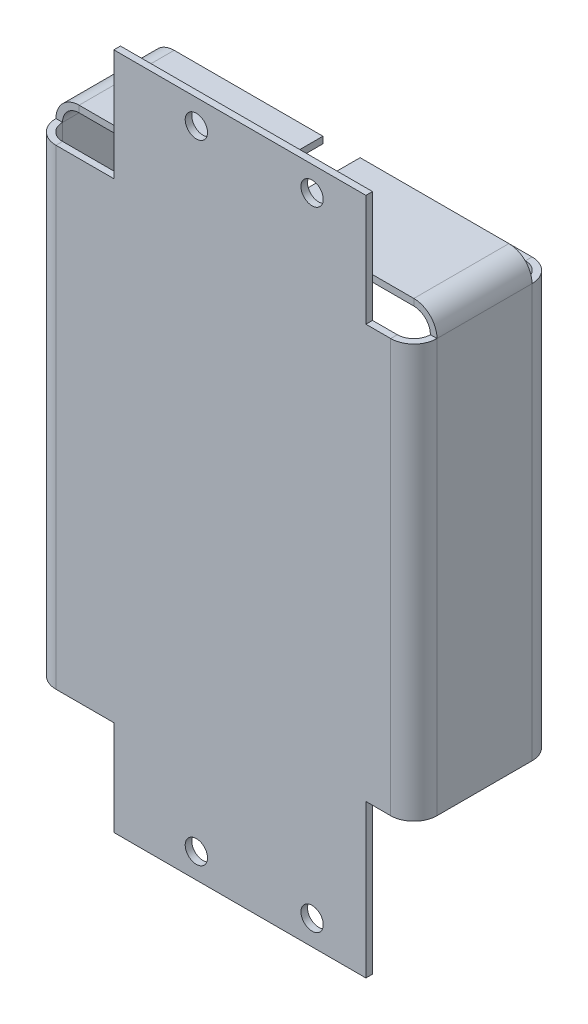
from build123d import *

# Parameters (mm, degrees)
SKETCH1_R                      = 1.35
BASE_FLANGE1_DEPTH             = 0.8
EDGE_FLANGE1_STRIP_W           = 7.2
EDGE_FLANGE1_STRIP_H           = 0.8
EDGE_FLANGE1_STRIP_CUT_DEPTH   = 50
EDGE_FLANGE1_STRIP_2_W         = 7.2
EDGE_FLANGE1_STRIP_2_H         = 0.8
EDGE_FLANGE1_STRIP_CUT_2_DEPTH = 57
EDGE_FLANGE1_DEPTH             = 50
EDGE_FLANGE1_BEND_DEPTH        = 57
EDGE_FLANGE4_DEPTH             = 11.5
EDGE_FLANGE4_BEND_DEPTH        = 11.5
EDGE_FLANGE5_DEPTH             = 50
EDGE_FLANGE5_BEND_DEPTH        = 57


# Sheet-metal steps are written as plain solids
with BuildPart() as part:
    # Sketch1 → Base-Flange1 (new body)
    with BuildSketch(Plane.XY):
        Polygon((16.75, 0), (16.75, -18.5), (-13.75, -18.5), (-13.75, -7), (-22.75, -7), (-22.75, 50), (-13.75, 50), (-13.75, 63.5), (16.75, 63.5), (16.75, 50), (21.75, 50), (21.75, 0), align=None)
        with Locations((10.237756115, -15.5)):
            Circle(SKETCH1_R, mode=Mode.SUBTRACT)
        with Locations((-3.762243885, -15.5)):
            Circle(SKETCH1_R, mode=Mode.SUBTRACT)
        with Locations((10.237756115, 60.5)):
            Circle(SKETCH1_R, mode=Mode.SUBTRACT)
        with Locations((-3.762243885, 60.5)):
            Circle(SKETCH1_R, mode=Mode.SUBTRACT)
    extrude(amount=BASE_FLANGE1_DEPTH)

    # Edge-Flange1 strip (across the edge) → Edge-Flange1 strip cut (cut)
    with BuildSketch(Plane(origin=(21.75, 50, 0), x_dir=(-1, 0, 0), z_dir=(0, -1, 0))):
        with Locations((-1.6, -0.4)):
            Rectangle(EDGE_FLANGE1_STRIP_W, EDGE_FLANGE1_STRIP_H)
    extrude(amount=EDGE_FLANGE1_STRIP_CUT_DEPTH, mode=Mode.SUBTRACT)

    # Edge-Flange1 strip 2 (across the edge) → Edge-Flange1 strip cut 2 (cut)
    with BuildSketch(Plane(origin=(-22.75, -7, 0), x_dir=(1, 0, 0), z_dir=(0, 1, 0))):
        with Locations((-1.6, -0.4)):
            Rectangle(EDGE_FLANGE1_STRIP_2_W, EDGE_FLANGE1_STRIP_2_H)
    extrude(amount=EDGE_FLANGE1_STRIP_CUT_2_DEPTH, mode=Mode.SUBTRACT)

    # Edge-Flange1 section (across the edge) → Edge-Flange1 (add)
    with BuildSketch(Plane(origin=(21.75, 50, 0), x_dir=(-1, 0, 0), z_dir=(0, -1, 0))):
        with BuildLine():
            Line((-0.8, 2), (-0.8, 13.5))
            Line((-0.8, 13.5), (0, 13.5))
            Line((0, 13.5), (0, 2))
            ThreePointArc((0, 2), (0.585786438, 0.585786438), (2, 0))
            Line((2, 0), (2, -0.8))
            ThreePointArc((2, -0.8), (0.020101013, 0.020101013), (-0.8, 2))
        make_face()
    extrude(amount=EDGE_FLANGE1_DEPTH)

    # Edge-Flange1 section 2 (across the edge) → Edge-Flange1 bend (add)
    with BuildSketch(Plane(origin=(-22.75, -7, 0), x_dir=(1, 0, 0), z_dir=(0, 1, 0))):
        with BuildLine():
            Line((-0.8, 2), (-0.8, 13.5))
            Line((-0.8, 13.5), (0, 13.5))
            Line((0, 13.5), (0, 2))
            ThreePointArc((0, 2), (0.585786438, 0.585786438), (2, 0))
            Line((2, 0), (2, -0.8))
            ThreePointArc((2, -0.8), (0.020101013, 0.020101013), (-0.8, 2))
        make_face()
    extrude(amount=EDGE_FLANGE1_BEND_DEPTH)

    # Edge-Flange4 section (across the edge) → Edge-Flange4 (add)
    with BuildSketch(Plane(origin=(21.75, 52, -2), x_dir=(0, -1, 0), z_dir=(0, 0, -1))):
        with BuildLine():
            Line((-0.8, 2), (-0.8, 20))
            Line((-0.8, 20), (0, 20))
            Line((0, 20), (0, 2))
            ThreePointArc((0, 2), (0.585786438, 0.585786438), (2, 0))
            Line((2, 0), (2, -0.8))
            ThreePointArc((2, -0.8), (0.020101013, 0.020101013), (-0.8, 2))
        make_face()
    extrude(amount=EDGE_FLANGE4_DEPTH)

    # Edge-Flange4 section 2 (across the edge) → Edge-Flange4 bend (add)
    with BuildSketch(Plane(origin=(-22.75, 52, -13.5), x_dir=(0, -1, 0), z_dir=(0, 0, 1))):
        with BuildLine():
            Line((-0.8, 2), (-0.8, 20))
            Line((-0.8, 20), (0, 20))
            Line((0, 20), (0, 2))
            ThreePointArc((0, 2), (0.585786438, 0.585786438), (2, 0))
            Line((2, 0), (2, -0.8))
            ThreePointArc((2, -0.8), (0.020101013, 0.020101013), (-0.8, 2))
        make_face()
    extrude(amount=EDGE_FLANGE4_BEND_DEPTH)

    # Edge-Flange5 section (across the edge) → Edge-Flange5 (add)
    with BuildSketch(Plane(origin=(21.75, 50, -15.5), x_dir=(0, 0, 1), z_dir=(0, -1, 0))):
        with BuildLine():
            Line((-0.8, 2), (-0.8, 10))
            Line((-0.8, 10), (0, 10))
            Line((0, 10), (0, 2))
            ThreePointArc((0, 2), (0.585786438, 0.585786438), (2, 0))
            Line((2, 0), (2, -0.8))
            ThreePointArc((2, -0.8), (0.020101013, 0.020101013), (-0.8, 2))
        make_face()
    extrude(amount=EDGE_FLANGE5_DEPTH)

    # Edge-Flange5 section 2 (across the edge) → Edge-Flange5 bend (add)
    with BuildSketch(Plane(origin=(-22.75, -7, -15.5), x_dir=(0, 0, 1), z_dir=(0, 1, 0))):
        with BuildLine():
            Line((-0.8, 2), (-0.8, 10))
            Line((-0.8, 10), (0, 10))
            Line((0, 10), (0, 2))
            ThreePointArc((0, 2), (0.585786438, 0.585786438), (2, 0))
            Line((2, 0), (2, -0.8))
            ThreePointArc((2, -0.8), (0.020101013, 0.020101013), (-0.8, 2))
        make_face()
    extrude(amount=EDGE_FLANGE5_BEND_DEPTH)


solid = part.part
